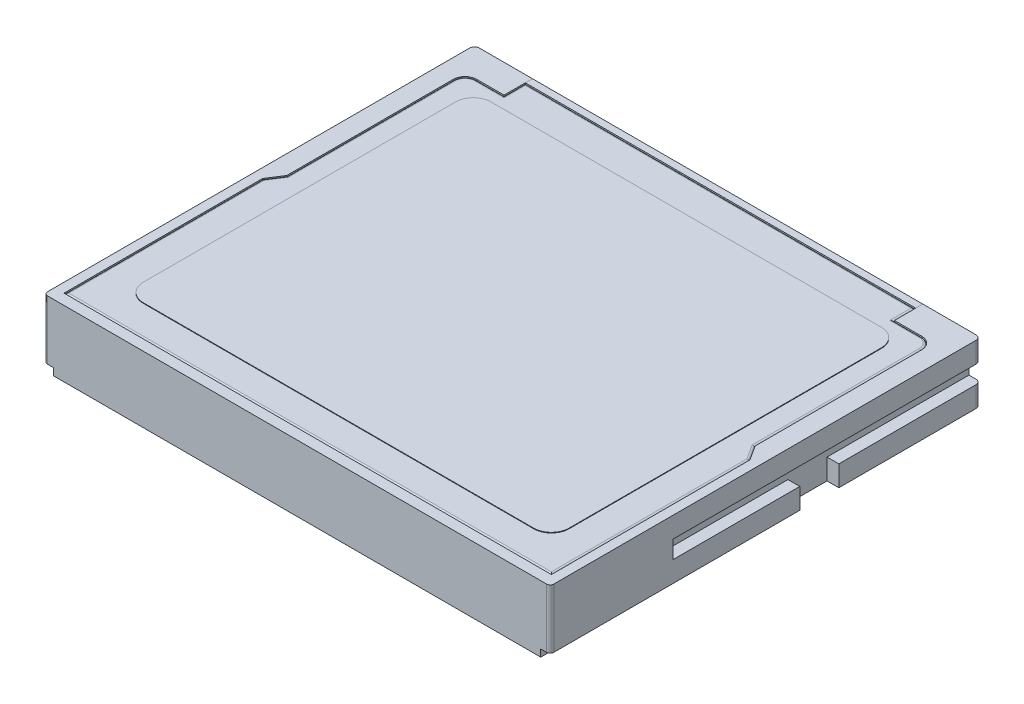
from build123d import *

# Parameters (mm, degrees)
CROQUIS1_W            = 42.8
CROQUIS1_H            = 5
EXTRUIR1_DEPTH        = 36.4
CROQUIS2_W            = 1.54600823
CROQUIS2_H            = 1.5
CORTAR_EXTRUIR1_DEPTH = 26
CROQUIS3_W            = 3.200695968
CROQUIS3_H            = 3.3
CORTAR_EXTRUIR2_DEPTH = 2
CROQUIS6_R            = 0.25
CORTAR_EXTRUIR3_DEPTH = 10
REDONDEO1_R           = 0.4
REDONDEO2_R           = 0.3
CHAFL_N1_SIZE         = 0.25
CROQUIS7_W            = 41.2
CROQUIS7_H            = 0.9
EXTRUIR2_DEPTH        = 0.6
CORTAR_EXTRUIR4_DEPTH = 0.5
EXTRUIR3_DEPTH        = 0.5
REDONDEO3_R           = 0.2
EXTRUIR4_DEPTH        = 0.5
REDONDEO4_R           = 0.2
EXTRUIR5_DEPTH        = 0.05


with BuildPart() as part:
    # Croquis1 → Extruir1 (new body)
    with BuildSketch(Plane.XY):
        Rectangle(CROQUIS1_W, CROQUIS1_H)
    extrude(amount=EXTRUIR1_DEPTH)

    # Croquis2 → Cortar-Extruir1 (cut)
    with BuildSketch(Plane(origin=(0, 0, 0), x_dir=(-1, 0, 0), z_dir=(0, 0, -1))):
        with Locations((21.173004115, 0)):
            Rectangle(CROQUIS2_W, CROQUIS2_H)
        with Locations((-21.173004115, 0)):
            Rectangle(CROQUIS2_W, CROQUIS2_H)
    extrude(amount=-CORTAR_EXTRUIR1_DEPTH, mode=Mode.SUBTRACT)

    # Croquis3 → Cortar-Extruir2 (cut)
    with BuildSketch(Plane.XZ.offset(2.5)):
        with Locations((22.000347984, 13.65)):
            Rectangle(CROQUIS3_W, CROQUIS3_H)
        with Locations((-22.000347984, 13.65)):
            Rectangle(CROQUIS3_W, CROQUIS3_H)
    extrude(amount=-CORTAR_EXTRUIR2_DEPTH, mode=Mode.SUBTRACT)

    # Croquis6 → Cortar-Extruir3 (cut)
    with BuildSketch(Plane(origin=(0, 0, 0), x_dir=(-1, 0, 0), z_dir=(0, 0, -1))):
        with Locations((0, -0.625)):
            Circle(CROQUIS6_R)
        with Locations((0, 0.625)):
            Circle(CROQUIS6_R)
        with Locations((-1.25, -0.625)):
            Circle(CROQUIS6_R)
        with Locations((-1.25, 0.625)):
            Circle(CROQUIS6_R)
        with Locations((-2.5, -0.625)):
            Circle(CROQUIS6_R)
        with Locations((-2.5, 0.625)):
            Circle(CROQUIS6_R)
        with Locations((-3.75, -0.625)):
            Circle(CROQUIS6_R)
        with Locations((-3.75, 0.625)):
            Circle(CROQUIS6_R)
        with Locations((-5, -0.625)):
            Circle(CROQUIS6_R)
        with Locations((-5, 0.625)):
            Circle(CROQUIS6_R)
        with Locations((-6.25, -0.625)):
            Circle(CROQUIS6_R)
        with Locations((-6.25, 0.625)):
            Circle(CROQUIS6_R)
        with Locations((-7.5, -0.625)):
            Circle(CROQUIS6_R)
        with Locations((-7.5, 0.625)):
            Circle(CROQUIS6_R)
        with Locations((-8.75, -0.625)):
            Circle(CROQUIS6_R)
        with Locations((-8.75, 0.625)):
            Circle(CROQUIS6_R)
        with Locations((-10, -0.625)):
            Circle(CROQUIS6_R)
        with Locations((-10, 0.625)):
            Circle(CROQUIS6_R)
        with Locations((-11.25, -0.625)):
            Circle(CROQUIS6_R)
        with Locations((-11.25, 0.625)):
            Circle(CROQUIS6_R)
        with Locations((-12.5, -0.625)):
            Circle(CROQUIS6_R)
        with Locations((-12.5, 0.625)):
            Circle(CROQUIS6_R)
        with Locations((-13.75, -0.625)):
            Circle(CROQUIS6_R)
        with Locations((-13.75, 0.625)):
            Circle(CROQUIS6_R)
        with Locations((-15, -0.625)):
            Circle(CROQUIS6_R)
        with Locations((-15, 0.625)):
            Circle(CROQUIS6_R)
        with Locations(Location((15, 0.625, 0), (0, 0, 180))):
            Circle(CROQUIS6_R)
        with Locations(Location((15, -0.625, 0), (0, 0, 180))):
            Circle(CROQUIS6_R)
        with Locations(Location((13.75, 0.625, 0), (0, 0, 180))):
            Circle(CROQUIS6_R)
        with Locations(Location((13.75, -0.625, 0), (0, 0, 180))):
            Circle(CROQUIS6_R)
        with Locations(Location((12.5, 0.625, 0), (0, 0, 180))):
            Circle(CROQUIS6_R)
        with Locations(Location((12.5, -0.625, 0), (0, 0, 180))):
            Circle(CROQUIS6_R)
        with Locations(Location((11.25, 0.625, 0), (0, 0, 180))):
            Circle(CROQUIS6_R)
        with Locations(Location((11.25, -0.625, 0), (0, 0, 180))):
            Circle(CROQUIS6_R)
        with Locations(Location((10, 0.625, 0), (0, 0, 180))):
            Circle(CROQUIS6_R)
        with Locations(Location((10, -0.625, 0), (0, 0, 180))):
            Circle(CROQUIS6_R)
        with Locations(Location((8.75, 0.625, 0), (0, 0, 180))):
            Circle(CROQUIS6_R)
        with Locations(Location((8.75, -0.625, 0), (0, 0, 180))):
            Circle(CROQUIS6_R)
        with Locations(Location((7.5, 0.625, 0), (0, 0, 180))):
            Circle(CROQUIS6_R)
        with Locations(Location((7.5, -0.625, 0), (0, 0, 180))):
            Circle(CROQUIS6_R)
        with Locations(Location((6.25, 0.625, 0), (0, 0, 180))):
            Circle(CROQUIS6_R)
        with Locations(Location((6.25, -0.625, 0), (0, 0, 180))):
            Circle(CROQUIS6_R)
        with Locations(Location((5, 0.625, 0), (0, 0, 180))):
            Circle(CROQUIS6_R)
        with Locations(Location((5, -0.625, 0), (0, 0, 180))):
            Circle(CROQUIS6_R)
        with Locations(Location((3.75, 0.625, 0), (0, 0, 180))):
            Circle(CROQUIS6_R)
        with Locations(Location((3.75, -0.625, 0), (0, 0, 180))):
            Circle(CROQUIS6_R)
        with Locations(Location((2.5, 0.625, 0), (0, 0, 180))):
            Circle(CROQUIS6_R)
        with Locations(Location((2.5, -0.625, 0), (0, 0, 180))):
            Circle(CROQUIS6_R)
        with Locations(Location((1.25, 0.625, 0), (0, 0, 180))):
            Circle(CROQUIS6_R)
        with Locations(Location((1.25, -0.625, 0), (0, 0, 180))):
            Circle(CROQUIS6_R)
    extrude(amount=-CORTAR_EXTRUIR3_DEPTH, mode=Mode.SUBTRACT)

    # Redondeo1
    redondeo1_edges = [part.edges().sort_by_distance(p)[0] for p in [
        (-21.4, -1.625, 0),
        (21.4, 1.625, 0),
        (21.4, -1.625, 0),
        (-21.4, 1.625, 0),
    ]]
    fillet(redondeo1_edges, radius=REDONDEO1_R)

    # Redondeo2
    redondeo2_edges = [part.edges().sort_by_distance(p)[0] for p in [
        (21.4, 0, 36.4),
        (-21.4, 0, 36.4),
    ]]
    fillet(redondeo2_edges, radius=REDONDEO2_R)

    # Chaflán1
    chafl_n1_edges = [part.edges().sort_by_distance(p)[0] for p in [
        (0.25, -0.625, 0),
        (0.25, 0.625, 0),
        (1.5, -0.625, 0),
        (1.5, 0.625, 0),
        (2.75, -0.625, 0),
        (2.75, 0.625, 0),
        (4, -0.625, 0),
        (4, 0.625, 0),
        (5.25, -0.625, 0),
        (5.25, 0.625, 0),
        (6.5, -0.625, 0),
        (6.5, 0.625, 0),
        (7.75, -0.625, 0),
        (7.75, 0.625, 0),
        (9, -0.625, 0),
        (9, 0.625, 0),
        (10.25, -0.625, 0),
        (10.25, 0.625, 0),
        (11.5, -0.625, 0),
        (11.5, 0.625, 0),
        (12.75, -0.625, 0),
        (12.75, 0.625, 0),
        (14, -0.625, 0),
        (14, 0.625, 0),
        (15.25, -0.625, 0),
        (15.25, 0.625, 0),
        (-15.25, 0.625, 0),
        (-15.25, -0.625, 0),
        (-14, 0.625, 0),
        (-14, -0.625, 0),
        (-12.75, 0.625, 0),
        (-12.75, -0.625, 0),
        (-11.5, 0.625, 0),
        (-11.5, -0.625, 0),
        (-10.25, 0.625, 0),
        (-10.25, -0.625, 0),
        (-9, 0.625, 0),
        (-9, -0.625, 0),
        (-7.75, 0.625, 0),
        (-7.75, -0.625, 0),
        (-6.5, 0.625, 0),
        (-6.5, -0.625, 0),
        (-5.25, 0.625, 0),
        (-5.25, -0.625, 0),
        (-4, 0.625, 0),
        (-4, -0.625, 0),
        (-2.75, 0.625, 0),
        (-2.75, -0.625, 0),
        (-1.5, 0.625, 0),
        (-1.5, -0.625, 0),
    ]]
    chamfer(chafl_n1_edges, length=CHAFL_N1_SIZE)

    # Croquis7 → Extruir2 (add)
    with BuildSketch(Plane.XZ.offset(2.5)):
        with Locations((0, 35.95)):
            Rectangle(CROQUIS7_W, CROQUIS7_H)
    extrude(amount=EXTRUIR2_DEPTH)

    # Croquis8 → Cortar-Extruir4 (cut)
    with BuildSketch(Plane.XZ.offset(2.5)):
        with BuildLine():
            Line((20.6, 35.5), (-20.6, 35.5))
            Line((-20.6, 35.5), (-20.6, 18.716547062))
            Line((-20.6, 18.716547062), (-19.8, 17.472488229))
            Line((-19.8, 17.472488229), (-19.8, 3.4))
            ThreePointArc((-19.8, 3.4), (-19.507106781, 2.692893219), (-18.8, 2.4))
            Line((-18.8, 2.4), (-16.5, 2.4))
            Line((-16.5, 2.4), (-16.5, 0.6))
            Line((-16.5, 0.6), (-1.033454181, 0.6))
            Line((-1.033454181, 0.6), (1.033454181, 0.6))
            Line((1.033454181, 0.6), (16.5, 0.6))
            Line((16.5, 0.6), (16.5, 2.4))
            Line((16.5, 2.4), (18.8, 2.4))
            ThreePointArc((18.8, 2.4), (19.507106781, 2.692893219), (19.8, 3.4))
            Line((19.8, 3.4), (19.8, 17.472488229))
            Line((19.8, 17.472488229), (20.6, 18.716547062))
            Line((20.6, 18.716547062), (20.6, 35.5))
        make_face()
    cortar_extruir4 = extrude(amount=-CORTAR_EXTRUIR4_DEPTH, mode=Mode.SUBTRACT)

    # Simetría1: Cortar-Extruir4 across plane
    add(cortar_extruir4.mirror(Plane.ZX), mode=Mode.SUBTRACT)


with BuildPart() as body_2:
    # Croquis9 → Extruir3 (new body)
    with BuildSketch(Plane.XZ.offset(2)):
        with BuildLine():
            Line((-19.8, 17.472488229), (-19.8, 3.4))
            ThreePointArc((-19.8, 3.4), (-19.507106781, 2.692893219), (-18.8, 2.4))
            Line((-18.8, 2.4), (-16.5, 2.4))
            Line((-16.5, 2.4), (-16.5, 0.6))
            Line((-16.5, 0.6), (16.5, 0.6))
            Line((16.5, 0.6), (16.5, 2.4))
            Line((16.5, 2.4), (18.8, 2.4))
            ThreePointArc((18.8, 2.4), (19.507106781, 2.692893219), (19.8, 3.4))
            Line((19.8, 3.4), (19.8, 17.472488229))
            Line((19.8, 17.472488229), (20.6, 18.716547062))
            Line((20.6, 18.716547062), (20.6, 35.5))
            Line((20.6, 35.5), (-20.6, 35.5))
            Line((-20.6, 35.5), (-20.6, 18.716547062))
            Line((-20.6, 18.716547062), (-19.8, 17.472488229))
        make_face()
    extrude(amount=EXTRUIR3_DEPTH)

    # Redondeo3
    redondeo3_edges = [body_2.edges().sort_by_distance(p)[0] for p in [
        (-19.507106781, -2.5, 2.692893219),
        (-17.65, -2.5, 2.4),
        (-16.5, -2.5, 1.5),
        (0, -2.5, 0.6),
        (16.5, -2.5, 1.5),
        (17.65, -2.5, 2.4),
        (19.507106781, -2.5, 2.692893219),
        (19.8, -2.5, 10.436244115),
        (20.2, -2.5, 18.094517646),
        (20.6, -2.5, 27.108273531),
        (-20.2, -2.5, 18.094517646),
        (0, -2.5, 35.5),
        (-20.6, -2.5, 27.108273531),
        (-19.8, -2.5, 10.436244115),
    ]]
    fillet(redondeo3_edges, radius=REDONDEO3_R)


with BuildPart() as body_3:
    # Croquis10 → Extruir4 (new body)
    with BuildSketch(Plane(origin=(0, 2, 0), x_dir=(-1, 0, 0), z_dir=(0, 1, 0))):
        with BuildLine():
            Line((19.8, 3.4), (19.8, 17.472488229))
            Line((19.8, 17.472488229), (20.6, 18.716547062))
            Line((20.6, 18.716547062), (20.6, 35.5))
            Line((20.6, 35.5), (-20.6, 35.5))
            Line((-20.6, 35.5), (-20.6, 18.716547062))
            Line((-20.6, 18.716547062), (-19.8, 17.472488229))
            Line((-19.8, 17.472488229), (-19.8, 3.4))
            ThreePointArc((-19.8, 3.4), (-19.507106781, 2.692893219), (-18.8, 2.4))
            Line((-18.8, 2.4), (-16.5, 2.4))
            Line((-16.5, 2.4), (-16.5, 0.6))
            Line((-16.5, 0.6), (16.5, 0.6))
            Line((16.5, 0.6), (16.5, 2.4))
            Line((16.5, 2.4), (18.8, 2.4))
            ThreePointArc((18.8, 2.4), (19.507106781, 2.692893219), (19.8, 3.4))
        make_face()
    extrude(amount=EXTRUIR4_DEPTH)

    # Redondeo4
    redondeo4_edges = [body_3.edges().sort_by_distance(p)[0] for p in [
        (-20.2, 2.5, 18.094517646),
        (-20.6, 2.5, 27.108273531),
        (0, 2.5, 35.5),
        (20.6, 2.5, 27.108273531),
        (20.2, 2.5, 18.094517646),
        (19.8, 2.5, 10.436244115),
        (19.507106781, 2.5, 2.692893219),
        (17.65, 2.5, 2.4),
        (16.5, 2.5, 1.5),
        (0, 2.5, 0.6),
        (-19.507106781, 2.5, 2.692893219),
        (-16.5, 2.5, 1.5),
        (-17.65, 2.5, 2.4),
        (-19.8, 2.5, 10.436244115),
    ]]
    fillet(redondeo4_edges, radius=REDONDEO4_R)


with BuildPart() as body_4:
    # Croquis13 → Extruir5 (new body)
    with BuildSketch(Plane(origin=(0, 2.5, 0), x_dir=(-1, 0, 0), z_dir=(0, 1, 0))):
        with BuildLine():
            Line((-16.5, 32.9), (16.5, 32.9))
            ThreePointArc((16.5, 32.9), (17.560660172, 32.460660172), (18, 31.4))
            Line((18, 31.4), (18, 5))
            ThreePointArc((18, 5), (17.560660172, 3.939339828), (16.5, 3.5))
            Line((16.5, 3.5), (-16.5, 3.5))
            ThreePointArc((-16.5, 3.5), (-17.560660172, 3.939339828), (-18, 5))
            Line((-18, 5), (-18, 31.4))
            ThreePointArc((-18, 31.4), (-17.560660172, 32.460660172), (-16.5, 32.9))
        make_face()
    extrude(amount=EXTRUIR5_DEPTH)


with BuildPart() as body_5:
    # Simetría2: mirrored copy
    add(body_4.part.mirror(Plane.ZX))


solid = Compound([part.part, body_2.part, body_3.part, body_4.part, body_5.part])
